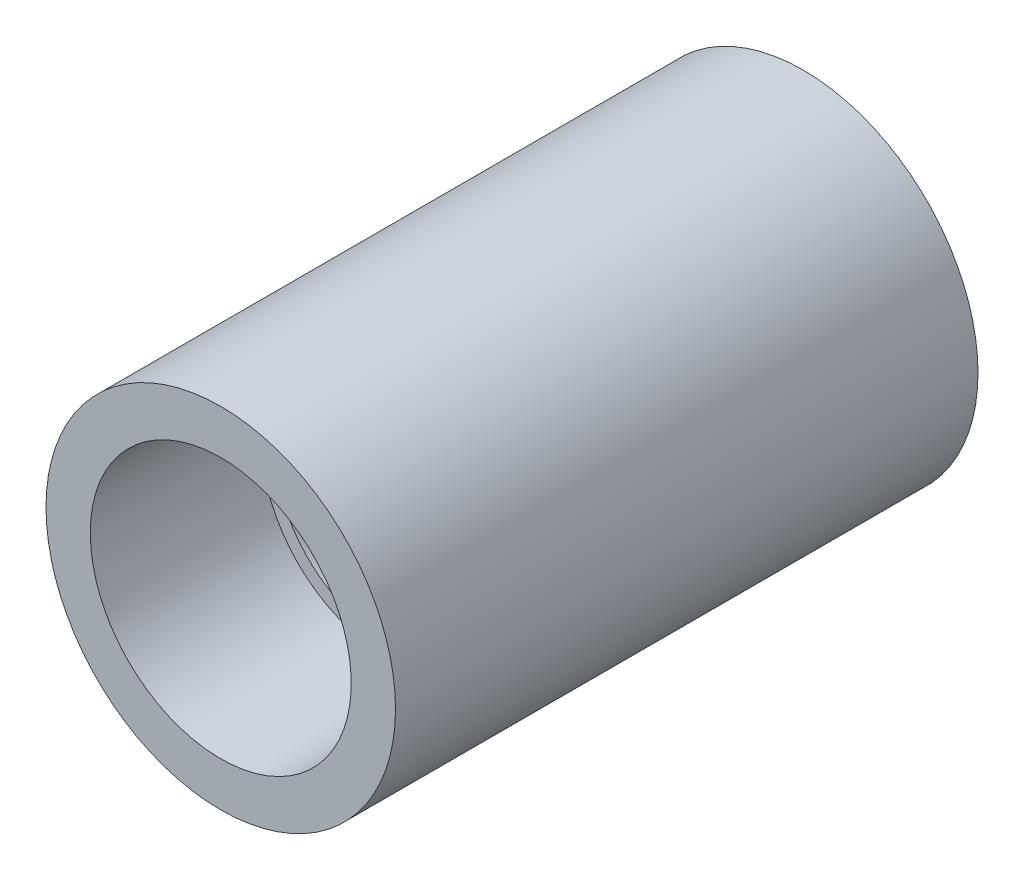
from build123d import *

# Parameters (mm, degrees)
BODYSCH_R       = 14.2875
BODY_DEPTH      = 47.625
FLOWSCH_R       = 9.128125
FLOW_DEPTH      = 20.3454
FLOWSMALLSCH_R  = 7.62
FLOWSMALL_DEPTH = 43.409911534


# Read off the part's stored shape, not the designer's step: Flow30deg
with BuildPart() as part:
    # BodySch → Body (new body)
    with BuildSketch(Plane.XY):
        Circle(BODYSCH_R)
    extrude(amount=BODY_DEPTH)

    # FlowSch → Flow (cut)
    with BuildSketch(Plane.XY.offset(47.625)):
        Circle(FLOWSCH_R)
    extrude(amount=-FLOW_DEPTH, mode=Mode.SUBTRACT)

    # ThreadSch → Thread (revolve, cut)
    with BuildSketch(Plane(origin=(0, 0, 0), x_dir=(0, 0, -1), z_dir=(1, 0, 0)), mode=Mode.PRIVATE) as thread_sk:
        Polygon((-34.0614, 0), (-34.0614, 10.24569605), (-47.625, 10.668), (-47.625, 0), align=None)
    revolve(thread_sk.sketch.rotate(Axis((0, 0, 0), (0, 0, 1)), 90), axis=Axis((0, 0, 0), (0, 0, 1)), mode=Mode.SUBTRACT)

    # ThreadSmallSke → ThreadSmall (revolve, cut)
    with BuildSketch(Plane(origin=(0, 0, 0), x_dir=(0, 0, -1), z_dir=(1, 0, 0)), mode=Mode.PRIVATE) as threadsmall_sk:
        Polygon((0, 0), (0, 8.5725), (-10.3378, 8.250631633), (-10.3378, 0), (-0.549620086, 0), align=None)
    revolve(threadsmall_sk.sketch.rotate(Axis((0, 0, 0), (0, 0, 1)), 90), axis=Axis((0, 0, 0), (0, 0, 1)), mode=Mode.SUBTRACT)

    # Flow30deg outline → Flow30deg (revolve, cut)
    with BuildSketch(Plane.XZ):
        Polygon((0, 27.2796), (0, 11.469223722), (9.128125, 27.2796), align=None)
    revolve(axis=Axis((0, 0, 0), (0, 0, 1)), mode=Mode.SUBTRACT)

    # FlowSmallSch → FlowSmall (cut, through all)
    with BuildSketch(Plane(origin=(0, 0, 10.3378), x_dir=(-1, 0, 0), z_dir=(0, 0, -1))):
        Circle(FLOWSMALLSCH_R)
    extrude(amount=-FLOWSMALL_DEPTH, mode=Mode.SUBTRACT)


solid = part.part
